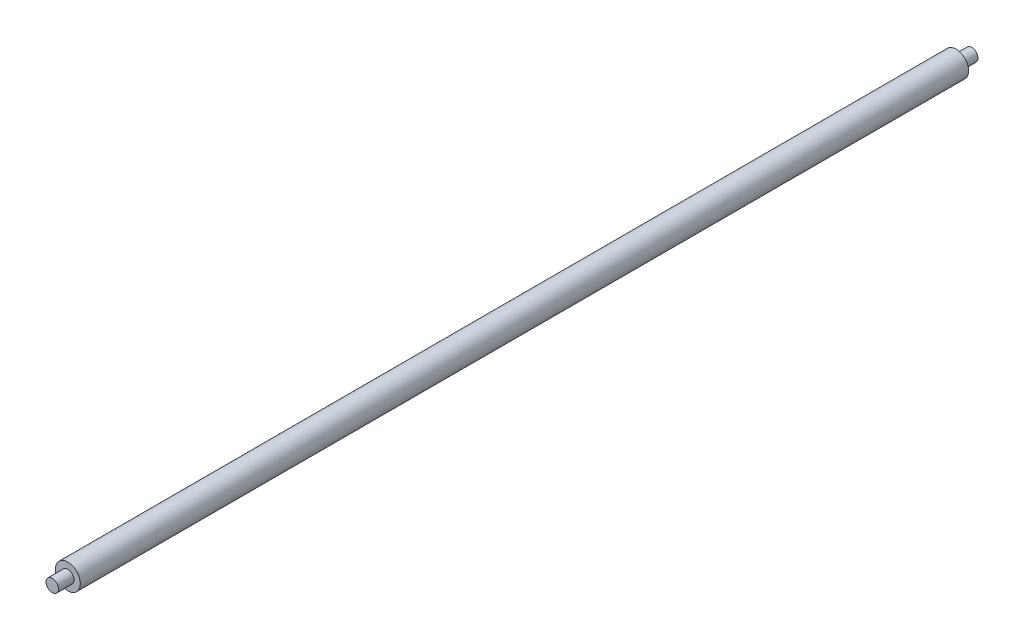
from build123d import *

# Parameters (mm, degrees)
SKETCH1_R           = 6
BOSS_EXTRUDE1_DEPTH = 213.75
SKETCH2_R           = 3
BOSS_EXTRUDE4_DEPTH = 7.5
BOSS_EXTRUDE5_START = 7.5
SKETCH3_R           = 3
BOSS_EXTRUDE5_DEPTH = 7.5


with BuildPart() as part:
    # Sketch1 → Boss-Extrude1 (new, symmetric)
    with BuildSketch(Plane.XY):
        Circle(SKETCH1_R)
    extrude(amount=BOSS_EXTRUDE1_DEPTH, both=True)

    # Sketch2 → Boss-Extrude4 (add)
    with BuildSketch(Plane.XY.offset(213.75)):
        Circle(SKETCH2_R)
    extrude(amount=BOSS_EXTRUDE4_DEPTH)

    # Sketch3 → Boss-Extrude5 (add)
    with BuildSketch(Plane(origin=(0, 0, -213.75), x_dir=(-1, 0, 0), z_dir=(0, 0, -1)).offset(BOSS_EXTRUDE5_START)):
        Circle(SKETCH3_R)
    extrude(amount=-BOSS_EXTRUDE5_DEPTH)


solid = part.part
